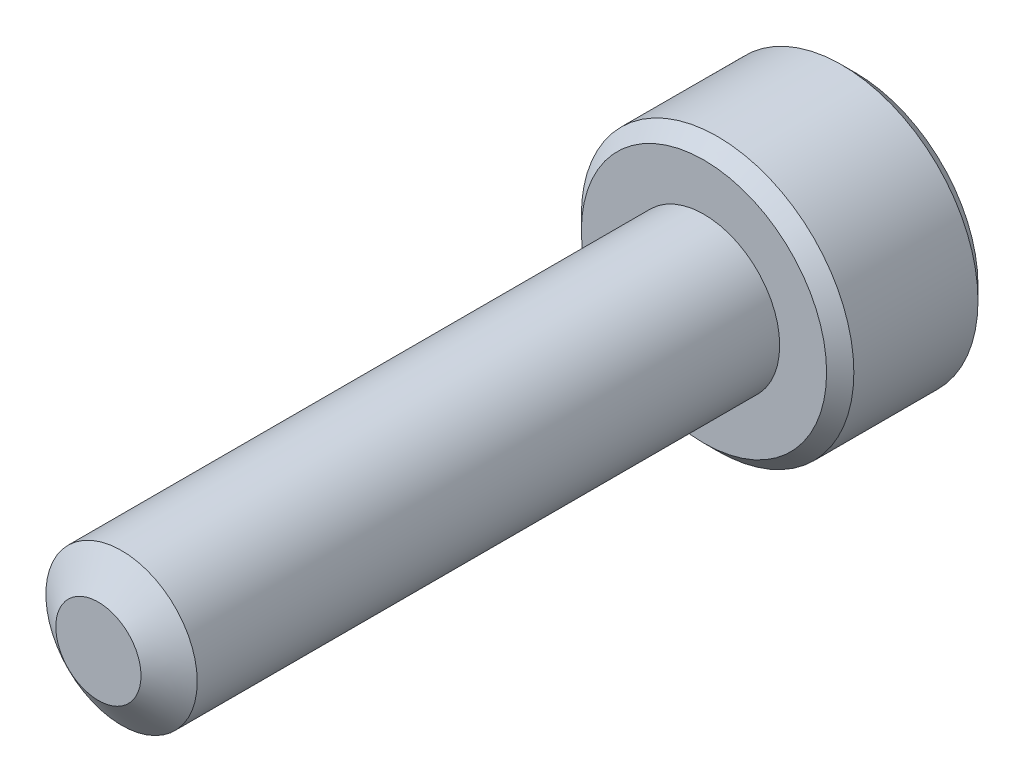
from build123d import *

# Parameters (mm, degrees)
SKETCH1_R          = 1.25
EXTRUDE1_DEPTH     = 10
SKETCH6_R          = 2.25
EXTRUDE2_DEPTH     = 2.5
CUT_EXTRUDE1_DEPTH = 1.5
CHAMFER1_SIZE      = 0.225


with BuildPart() as part:
    # Sketch1 → Extrude1 (new body)
    with BuildSketch(Plane.XY):
        Circle(SKETCH1_R)
    extrude(amount=-EXTRUDE1_DEPTH)

    # Sketch4 → Cut-Revolve1 (revolve, cut)
    with BuildSketch(Plane(origin=(0, 0, 0), x_dir=(0, 0, -1), z_dir=(1, 0, 0))):
        Polygon((0.382511876, 1.25), (0, 0.703716426), (0, 1.25), align=None)
    revolve(axis=Axis((0, 0, 0), (0, 0, -1)), mode=Mode.SUBTRACT)

    # Sketch6 → Extrude2 (add)
    with BuildSketch(Plane(origin=(0, 0, -10), x_dir=(-1, 0, 0), z_dir=(0, 0, -1))):
        Circle(SKETCH6_R)
    extrude(amount=EXTRUDE2_DEPTH)

    # Sketch7 → Cut-Extrude1 (cut)
    with BuildSketch(Plane(origin=(0, 0, -12.5), x_dir=(-1, 0, 0), z_dir=(0, 0, -1))):
        Polygon((0, 1.154700538), (-1, 0.577350269), (-1, -0.577350269), (0, -1.154700538), (1, -0.577350269), (1, 0.577350269), align=None)
    extrude(amount=-CUT_EXTRUDE1_DEPTH, mode=Mode.SUBTRACT)

    # Cut-Extrude2 cone 1 section (through the dimple's axis) → Cut-Extrude2 (revolve, cut)
    with BuildSketch(Plane(origin=(0, 0, -12.5), x_dir=(0, 1, 0), z_dir=(1, 0, 0))):
        Polygon((0, 0), (1.154700538, 0), (0, 1.154700538), align=None)
    revolve(axis=Axis((0, 0, -12.5), (0, 0, 1)), mode=Mode.SUBTRACT)

    # Chamfer1
    chamfer1_edges = [part.edges().sort_by_distance(p)[0] for p in [
        (2.25, 0, -12.5),
        (2.25, 0, -10),
    ]]
    chamfer(chamfer1_edges, length=CHAMFER1_SIZE)


solid = part.part
